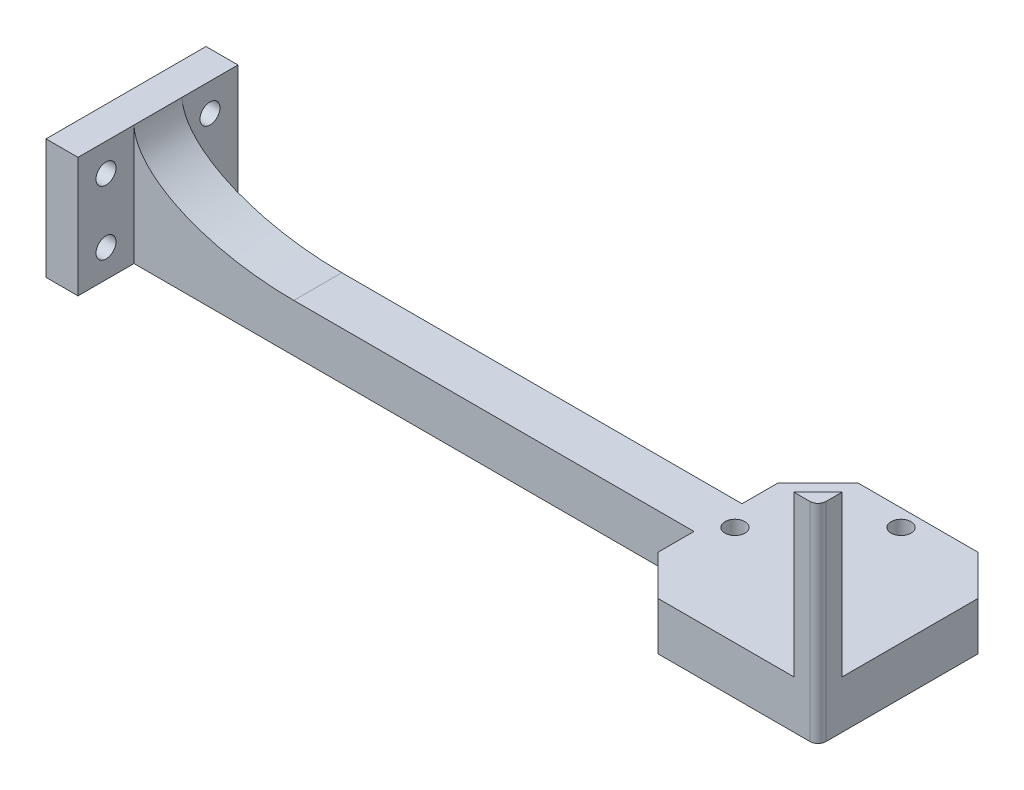
from build123d import *

# Parameters (mm, degrees)
ESQUISSE1_W                 = 50
ESQUISSE1_H                 = 50
ESQUISSE1_W_2               = 140
ESQUISSE1_H_2               = 12
BOSS_EXTRU_2_DEPTH          = 12
BOSS_EXTRU_3_DEPTH          = 30
ESQUISSE3_R                 = 4.25
ENL_V_MAT_EXTRU_1_DEPTH     = 110.627399686
ESQUISSE4_R                 = 2.5
ENL_V_MAT_EXTRU_2_DEPTH     = 8
CHANFREIN2_SIZE             = 10
CONG_1_START                = 0.042620229
CONG_1_DEPTH                = 12
BOSS_EXTRU_4_DEPTH          = 40
ENL_V_START                 = -12
ENL_V_MAT_EXTRU_3_OUTLINE_R = 2.5
ENL_V_MAT_EXTRU_3_DEPTH     = 52
ESQUISSE8_R                 = 2.5
ENL_V_MAT_EXTRU_4_DEPTH     = 12


with BuildPart() as part:
    # Esquisse1 → Boss.-Extru.2 (new body)
    with BuildSketch(Plane(origin=(0, 0, 0), x_dir=(1, 0, 0), z_dir=(0, 1, 0))):
        with Locations((69.411764706, -6.042620229)):
            Rectangle(ESQUISSE1_W, ESQUISSE1_H)
        with Locations((-25.588235294, -6.042620229)):
            Rectangle(ESQUISSE1_W_2, ESQUISSE1_H_2)
    extrude(amount=BOSS_EXTRU_2_DEPTH)

    # Esquisse2 → Boss.-Extru.3 (add)
    with BuildSketch(Plane(origin=(0, 0, 0), x_dir=(1, 0, 0), z_dir=(0, 1, 0))):
        Polygon((-95.588235294, -0.042620229), (-95.588235294, 13.957379771), (-103.588235294, 13.957379771), (-103.588235294, -26.042620229), (-95.588235294, -26.042620229), (-95.588235294, -12.042620229), align=None)
    extrude(amount=BOSS_EXTRU_3_DEPTH)

    # Esquisse3 → Enlèv. mat.-Extru.1 (cut, through all)
    with BuildSketch(Plane(origin=(0, 12, 0), x_dir=(1, 0, 0), z_dir=(0, 1, 0))):
        with Locations(Location((69.411764706, -6.042620229, 0), (0, 0, 270))):
            Circle(ESQUISSE3_R)
    extrude(amount=-ENL_V_MAT_EXTRU_1_DEPTH, mode=Mode.SUBTRACT)

    # Esquisse4 → Enlèv. mat.-Extru.2 (cut)
    with BuildSketch(Plane.ZY.offset(103.588235294)):
        with Locations((-6.957379771, 7)):
            Circle(ESQUISSE4_R)
        with Locations((19.042620229, 7)):
            Circle(ESQUISSE4_R)
        with Locations((19.042620229, 23)):
            Circle(ESQUISSE4_R)
        with Locations((-6.957379771, 23)):
            Circle(ESQUISSE4_R)
    extrude(amount=-ENL_V_MAT_EXTRU_2_DEPTH, mode=Mode.SUBTRACT)

    # Chanfrein2
    chanfrein2_edges = [part.edges().sort_by_distance(p)[0] for p in [
        (44.411764706, 6, 31.042620229),
        (44.411764706, 6, -18.957379771),
        (94.411764706, 6, -18.957379771),
    ]]
    chamfer(chanfrein2_edges, length=CHANFREIN2_SIZE)

    # Congé1: read off the stored shape, not the designer's step
    # Congé1 outline → Congé1 (add)
    with BuildSketch(Plane.XY.offset(CONG_1_START)):
        with BuildLine():
            add(Edge.make_bspline(
                [(-95.588235294, 30), (-94.68710818, 12), (-55.638266583, 12)],
                knots=[0, 0, 0, 1, 1, 1], degree=2, weights=[1, 0.724568837, 1]))
            Line((-95.588235294, 30), (-95.588235294, 12))
            Line((-95.588235294, 12), (-55.638266583, 12))
        make_face()
    extrude(amount=CONG_1_DEPTH)

    # Esquisse6 → Boss.-Extru.4 (add)
    with BuildSketch(Plane(origin=(0, 12, 0), x_dir=(1, 0, 0), z_dir=(0, 1, 0))):
        Polygon((94.411764706, -25.042620229), (88.411764706, -31.042620229), (94.411764706, -31.042620229), align=None)
    extrude(amount=BOSS_EXTRU_4_DEPTH)

    # Enlèv. mat.-Extru.3: read off the stored shape, not the designer's step
    # Enlèv. mat.-Extru.3 outline → Enlèv. mat.-Extru.3 (cut)
    with BuildSketch(Plane(origin=(0, 12, 0), x_dir=(1, 0, 0), z_dir=(0, 1, 0)).offset(ENL_V_START)):
        with BuildLine():
            ThreePointArc((94.411764706, -29.042620229), (93.825978268, -30.456833791), (92.411764706, -31.042620229))
            Line((92.411764706, -31.042620229), (94.411764706, -31.042620229))
            Line((94.411764706, -31.042620229), (94.411764706, -29.042620229))
        make_face()
        with Locations((87.411764706, -24.042620229)):
            Circle(ENL_V_MAT_EXTRU_3_OUTLINE_R)
    extrude(amount=ENL_V_MAT_EXTRU_3_DEPTH, mode=Mode.SUBTRACT)

    # Esquisse8 → Enlèv. mat.-Extru.4 (cut)
    with BuildSketch(Plane.XZ):
        with Locations(Location((48.651764706, 6.042620229, 0), (0, 0, 270))):
            Circle(ESQUISSE8_R)
        with Locations(Location((69.411764706, -14.717379771, 0), (0, 0, 270))):
            Circle(ESQUISSE8_R)
    extrude(amount=-ENL_V_MAT_EXTRU_4_DEPTH, mode=Mode.SUBTRACT)


solid = part.part
